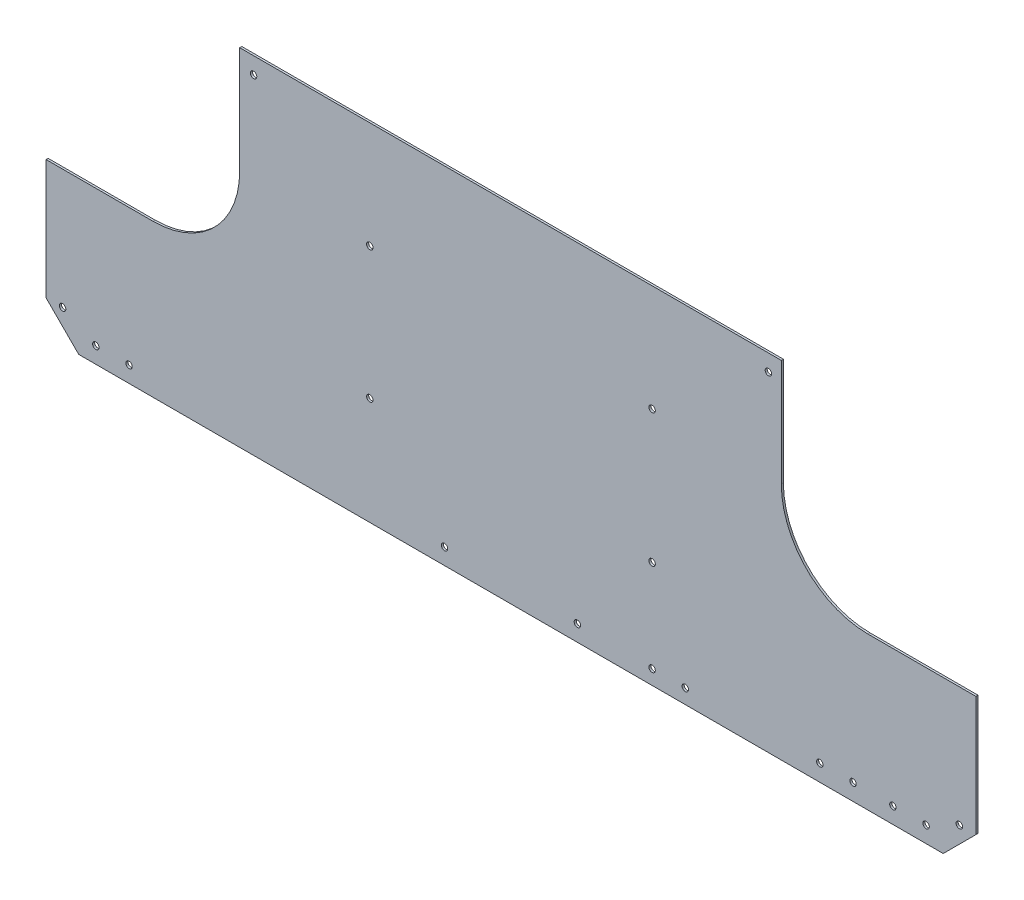
from build123d import *

# Parameters (mm, degrees)
SKETCH3_W                    = 914.4
SKETCH3_H                    = 609.6
BOSS_EXTRUDE1_DEPTH          = 0.79375
SKETCH4_OUTSIDE_W            = 1136.194
SKETCH4_OUTSIDE_H            = 831.394
CUT_EXTRUDE1_DEPTH           = 2.54
CUT_EXTRUDE2_DEPTH           = 2.54
CUT_EXTRUDE3_DEPTH           = 2.54
F_10_0_1935_DIAMETER_HOLE1_D = 4.9149
F_10_0_1935_DIAMETER_HOLE2_D = 4.9149


with BuildPart() as part:
    # Sketch3 → Boss-Extrude1 (new, symmetric)
    with BuildSketch(Plane.XY):
        Rectangle(SKETCH3_W, SKETCH3_H)
    extrude(amount=BOSS_EXTRUDE1_DEPTH, both=True)

    # Sketch4 outside → Cut-Extrude1 (cut)
    with BuildSketch(Plane.XY.offset(0.79375)):
        Rectangle(SKETCH4_OUTSIDE_W, SKETCH4_OUTSIDE_H)
        with BuildLine():
            Line((-352.134938229, -305.170644008), (-377.534938229, -279.770644008))
            Line((-377.534938229, -279.770644008), (-377.534938229, -42.598144008))
            ThreePointArc((-377.534938229, -42.598144008), (-376.790989453, -40.802092784), (-374.994938229, -40.058144008))
            Line((-374.994938229, -40.058144008), (331.125061771, -40.058144008))
            ThreePointArc((331.125061771, -40.058144008), (332.921112995, -40.802092784), (333.665061771, -42.598144008))
            Line((333.665061771, -42.598144008), (333.665061771, -279.770644008))
            Line((333.665061771, -279.770644008), (308.265061771, -305.170644008))
            Line((308.265061771, -305.170644008), (-352.134938229, -305.170644008))
        make_face(mode=Mode.SUBTRACT)
    extrude(amount=-CUT_EXTRUDE1_DEPTH, mode=Mode.SUBTRACT)

    # Sketch7 → Cut-Extrude2 (cut)
    with BuildSketch(Plane.XY.offset(0.79375)):
        with BuildLine():
            Line((-377.534938229, -188.190344021), (-377.534938229, -40.058144008))
            Line((-377.534938229, -40.058144008), (-229.402738216, -40.058144008))
            Line((-229.402738216, -40.058144008), (-229.402738216, -64.746344021))
            Line((-229.402738216, -64.746344021), (-229.402738216, -121.896344021))
            ThreePointArc((-229.402738216, -121.896344021), (-248.819801264, -168.773280973), (-295.696738216, -188.190344021))
            Line((-295.696738216, -188.190344021), (-352.846738216, -188.190344021))
            Line((-352.846738216, -188.190344021), (-377.534938229, -188.190344021))
        make_face()
    extrude(amount=-CUT_EXTRUDE2_DEPTH, mode=Mode.SUBTRACT)

    # Sketch8 → Cut-Extrude3 (cut)
    with BuildSketch(Plane.XY.offset(0.79375)):
        with BuildLine():
            Line((251.115061771, -188.190344021), (336.840061771, -188.190344021))
            Line((336.840061771, -188.190344021), (336.840061771, -36.171344021))
            Line((336.840061771, -36.171344021), (184.821061771, -36.171344021))
            Line((184.821061771, -36.171344021), (184.821061771, -121.896344021))
            ThreePointArc((184.821061771, -121.896344021), (204.238124819, -168.773280973), (251.115061771, -188.190344021))
        make_face()
    extrude(amount=-CUT_EXTRUDE3_DEPTH, mode=Mode.SUBTRACT)

    # #10 (0.1935) Diameter Hole1 (through all)
    with Locations(Plane.XY.offset(0.79375)):
        with Locations((-314.034938229, -292.470644008), (-339.434938229, -292.470644008), (-364.834938229, -279.770644008), (86.005546883, -293.702239208), (111.405546883, -293.702239208), (214.275546883, -292.114748821), (239.675546883, -292.114748821), (295.565062787, -292.470644008), (270.165062787, -292.470644008), (320.965062787, -279.770644008), (174.915061771, -52.758144008), (-218.784938229, -52.758144008), (-72.734937721, -292.470644008), (28.865062279, -292.470644008)):
            Hole(F_10_0_1935_DIAMETER_HOLE1_D / 2)

    # #10 (0.1935) Diameter Hole2 (through all)
    with Locations(Plane.XY.offset(0.79375)):
        with Locations((-129.88493833, -121.629072033), (-129.88493833, -222.541034234), (86.015061873, -223.229071976), (86.015061873, -121.629072033)):
            Hole(F_10_0_1935_DIAMETER_HOLE2_D / 2)


solid = part.part
